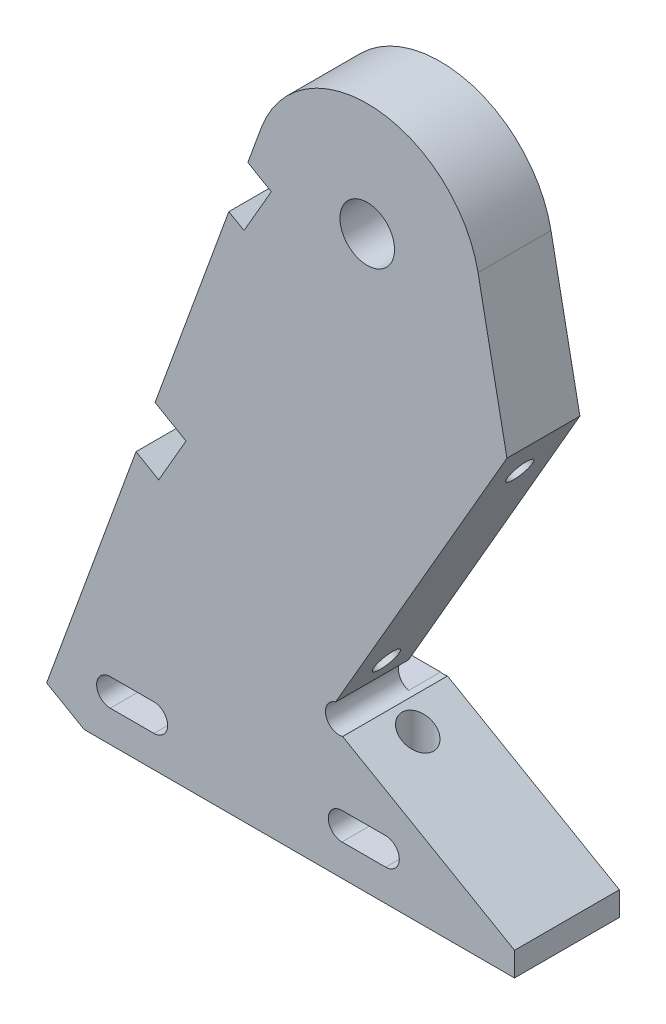
from build123d import *

# Parameters (mm, degrees)
MODEL_R                   = 3.175
BOSS_EXTRUDE1_DEPTH       = 8.4836
F_4_CLEARANCE_HOLE3_D     = 2.9464
F_4_CLEARANCE_HOLE4_D     = 2.9464
BOSS_EXTRUDE2_START       = 3.7084
BOSS_EXTRUDE2_DEPTH       = 3.7084
CUT_EXTRUDE1_DEPTH        = 60.573404892
F_6_CLEARANCE_HOLE2_D     = 3.6576
F_6_CLEARANCE_HOLE2_DEPTH = 14.3256
F_6_CLEARANCE_HOLE2_TIP   = 1.0988539


with BuildPart() as part:
    # Model → Boss-Extrude1 (new body)
    with BuildSketch(Plane.XY):
        with BuildLine():
            Line((30.032015577, -29.521189504), (30.032015577, -26.729824585))
            Line((30.032015577, -26.729824585), (10.04882977, -15.19252688))
            ThreePointArc((10.04882977, -15.19252688), (8.104547287, -14.069994865), (9.227079302, -12.125712382))
            Line((9.227079302, -12.125712382), (29.151876156, 22.3850481))
            Line((29.151876156, 22.3850481), (25.790540116, 39.397524407))
            ThreePointArc((25.790540116, 39.397524407), (13.922877184, 49.944916766), (0.570865514, 41.353485372))
            Line((0.570865514, 41.353485372), (-0.979565285, 37.104375313))
            Line((-0.979565285, 37.104375313), (1.753621818, 35.526369004))
            Line((1.753621818, 35.526369004), (-1.421378182, 30.02710769))
            Line((-1.421378182, 30.02710769), (-3.189468587, 31.047915161))
            Line((-3.189468587, 31.047915161), (-11.768069595, 7.537404491))
            Line((-11.768069595, 7.537404491), (-8.165923931, 5.457704722))
            Line((-8.165923931, 5.457704722), (-11.34077003, -0.041645446))
            Line((-11.34077003, -0.041645446), (-13.977972897, 1.480944339))
            Line((-13.977972897, 1.480944339), (-24.373743148, -27.00969967))
            Line((-24.373743148, -27.00969967), (-20.022585807, -29.521189504))
            Line((-20.022585807, -29.521189504), (30.032015577, -29.521189504))
        make_face()
        with Locations((12.90743615, 36.852072417)):
            Circle(MODEL_R, mode=Mode.SUBTRACT)
    extrude(amount=BOSS_EXTRUDE1_DEPTH)

    # #4 Clearance Hole3 (through all)
    with Locations(Plane(origin=(-14.068152667, 8.12225173, 0), x_dir=(0, 0, 1), z_dir=(-0.8660254037844389, 0.4999999999999996, 0))):
        with Locations((4.2418, 28.46854897)):
            Hole(F_4_CLEARANCE_HOLE3_D / 2)

    # #4 Clearance Hole4 (through all)
    with Locations(Plane(origin=(-8.487819953, 4.900128422, 0), x_dir=(0, 0, 1), z_dir=(-0.8660393963332388, 0.49997576341134725, 0))):
        with Locations((4.2418, -2.53117675)):
            Hole(F_4_CLEARANCE_HOLE4_D / 2)

    # Sketch12 → Boss-Extrude2 (add)
    with BuildSketch(Plane(origin=(0, 0, 0), x_dir=(-1, 0, 0), z_dir=(0, 0, -1)).offset(BOSS_EXTRUDE2_START)):
        with BuildLine():
            Line((20.062967478, -15.195589504), (-9.238684477, -15.195589504))
            ThreePointArc((-9.238684477, -15.195589504), (-9.643955781, -15.246608288), (-10.04882977, -15.19252688))
            Line((-10.04882977, -15.19252688), (-30.032015577, -26.729824585))
            Line((-30.032015577, -26.729824585), (-30.032015577, -29.521189504))
            Line((-30.032015577, -29.521189504), (20.022585807, -29.521189504))
            Line((20.022585807, -29.521189504), (24.373743148, -27.00969967))
            Line((24.373743148, -27.00969967), (20.062967478, -15.195589504))
        make_face()
    extrude(amount=-BOSS_EXTRUDE2_DEPTH)

    # Sketch14 → Cut-Extrude1 (cut, through all)
    with BuildSketch(Plane.XY.offset(8.4836)):
        with BuildLine():
            Line((-16.974585807, -22.675889504), (-11.894585807, -22.675889504))
            ThreePointArc((-11.894585807, -22.675889504), (-10.307085807, -24.263389504), (-11.894585807, -25.850889504))
            Line((-11.894585807, -25.850889504), (-16.974585807, -25.850889504))
            ThreePointArc((-16.974585807, -25.850889504), (-18.562085807, -24.263389504), (-16.974585807, -22.675889504))
        make_face()
        with BuildLine():
            Line((9.966182511, -22.675889504), (15.046182511, -22.675889504))
            ThreePointArc((15.046182511, -22.675889504), (16.633682511, -24.263389504), (15.046182511, -25.850889504))
            Line((15.046182511, -25.850889504), (9.966182511, -25.850889504))
            ThreePointArc((9.966182511, -25.850889504), (8.378682511, -24.263389504), (9.966182511, -22.675889504))
        make_face()
    extrude(amount=-CUT_EXTRUDE1_DEPTH, mode=Mode.SUBTRACT)

    # #6 Clearance Hole2
    with Locations(Plane(origin=(0, -29.521189504, 0), x_dir=(-1, 0, 0), z_dir=(0, -1, 0))):
        with Locations((14.433829056, -2.212184194), (-12.506939307, -2.212184194)):
            Hole(F_6_CLEARANCE_HOLE2_D / 2, depth=F_6_CLEARANCE_HOLE2_DEPTH)
            with Locations((0, 0, -(F_6_CLEARANCE_HOLE2_DEPTH + F_6_CLEARANCE_HOLE2_TIP / 2))):  # 118° drill point
                Cone(0, F_6_CLEARANCE_HOLE2_D / 2, F_6_CLEARANCE_HOLE2_TIP, mode=Mode.SUBTRACT)


solid = part.part
